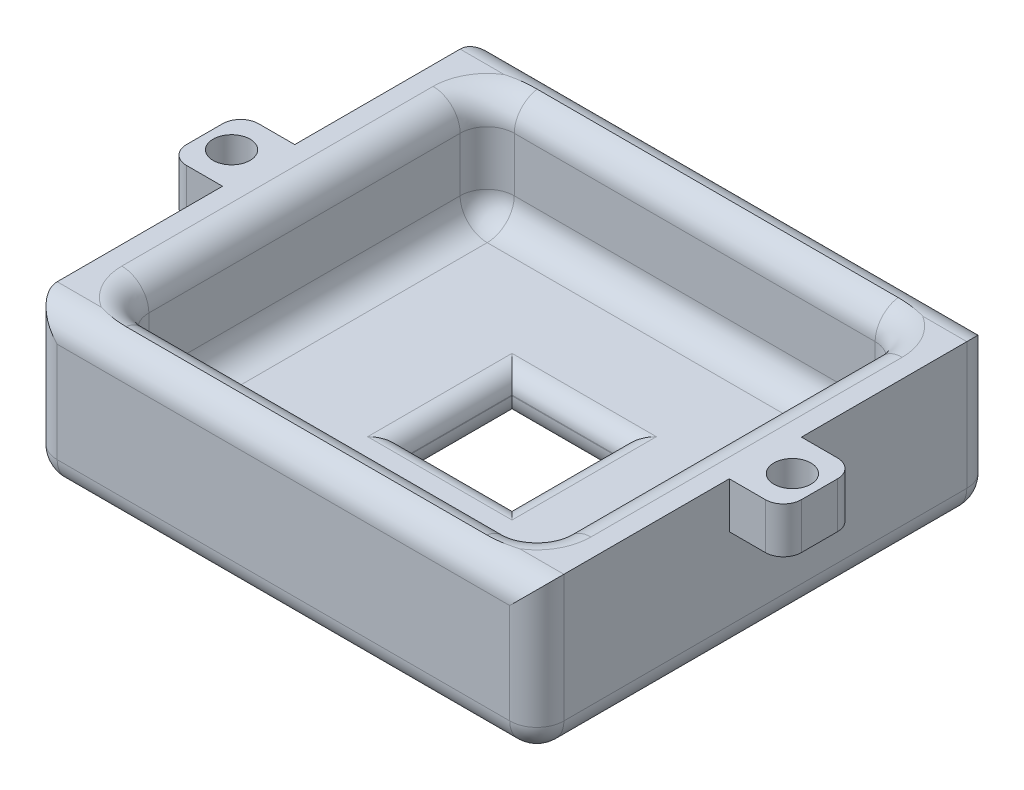
from build123d import *

# Parameters (mm, degrees)
SKETCH1_W           = 56.16
SKETCH1_H           = 50.66
SKETCH1_W_2         = 46
SKETCH1_H_2         = 40.5
BOSS_EXTRUDE1_DEPTH = 12
SKETCH2_W           = 56.16
SKETCH2_H           = 50.66
BOSS_EXTRUDE2_DEPTH = 5.08
SKETCH3_W           = 12
SKETCH3_H           = 12
CUT_EXTRUDE1_DEPTH  = 5.08
SKETCH4_W           = 8
SKETCH4_H           = 5.08
BOSS_EXTRUDE3_DEPTH = 6
SKETCH5_W           = 8
SKETCH5_H           = 5.08
BOSS_EXTRUDE4_DEPTH = 6
SKETCH6_R           = 2.05
CUT_EXTRUDE2_DEPTH  = 6
FILLET1_R           = 3
FILLET2_R           = 2
FILLET3_R           = 2


with BuildPart() as part:
    # Sketch1 → Boss-Extrude1 (new body)
    with BuildSketch(Plane(origin=(0, 0, 0), x_dir=(1, 0, 0), z_dir=(0, 1, 0))):
        with Locations((4.455, -0.70125)):
            Rectangle(SKETCH1_W, SKETCH1_H)
        with Locations((4.455, -0.70125)):
            Rectangle(SKETCH1_W_2, SKETCH1_H_2, mode=Mode.SUBTRACT)
    extrude(amount=BOSS_EXTRUDE1_DEPTH)

    # Sketch2 → Boss-Extrude2 (add)
    with BuildSketch(Plane.XZ):
        with Locations((4.455, 0.70125)):
            Rectangle(SKETCH2_W, SKETCH2_H)
    extrude(amount=BOSS_EXTRUDE2_DEPTH)

    # Sketch3 → Cut-Extrude1 (cut)
    with BuildSketch(Plane.XZ.offset(5.08)):
        with Locations((4.455, 0.70125)):
            Rectangle(SKETCH3_W, SKETCH3_H)
    extrude(amount=-CUT_EXTRUDE1_DEPTH, mode=Mode.SUBTRACT)

    # Sketch4 → Boss-Extrude3 (add)
    with BuildSketch(Plane(origin=(32.535, 0, 0), x_dir=(0, 0, -1), z_dir=(1, 0, 0))):
        with Locations((-0.70125, 9.46)):
            Rectangle(SKETCH4_W, SKETCH4_H)
    extrude(amount=BOSS_EXTRUDE3_DEPTH)

    # Sketch5 → Boss-Extrude4 (add)
    with BuildSketch(Plane.ZY.offset(23.625)):
        with Locations((0.70125, 9.46)):
            Rectangle(SKETCH5_W, SKETCH5_H)
    extrude(amount=BOSS_EXTRUDE4_DEPTH)

    # Sketch6 → Cut-Extrude2 (cut)
    with BuildSketch(Plane.XZ.offset(-6.92)):
        with Locations(Location((35.535, 0.70125, 0), (0, 0, 270))):
            Circle(SKETCH6_R)
        with Locations(Location((-26.625, 0.70125, 0), (0, 0, 270))):
            Circle(SKETCH6_R)
    extrude(amount=-CUT_EXTRUDE2_DEPTH, mode=Mode.SUBTRACT)

    # Fillet1
    # the kernel refuses this fillet: 3 mm, written as the material it adds along each edge
    with BuildSketch(Plane(origin=(-15.545, 3, 17.95125), x_dir=(-1, 0, 0), z_dir=(0, -1, 0))) as fillet1_piece_1_section:
        Polygon((0, 0), (FILLET1_R, 0), (FILLET1_R, -FILLET1_R), (0, -FILLET1_R), align=None)
    fillet1_piece_1 = extrude(amount=FILLET1_R, mode=Mode.PRIVATE)
    fillet1_piece_1 = fillet1_piece_1 - Plane(origin=(-15.545, 3, 17.95125), x_dir=(0.7071067811865475, 0, -0.7071067811865475), z_dir=(0, -1, 0)) * Sphere(FILLET1_R, mode=Mode.PRIVATE)
    add(fillet1_piece_1)
    with BuildSketch(Plane(origin=(-15.545, 3, -16.54875), x_dir=(-1, 0, 0), z_dir=(0, -1, 0))) as fillet1_piece_2_section:
        Polygon((0, 0), (FILLET1_R, 0), (FILLET1_R, FILLET1_R), (0, FILLET1_R), align=None)
    fillet1_piece_2 = extrude(amount=FILLET1_R, mode=Mode.PRIVATE)
    fillet1_piece_2 = fillet1_piece_2 - Plane(origin=(-15.545, 3, -16.54875), x_dir=(0.7071067811865476, 0, 0.7071067811865475), z_dir=(0, -1, 0)) * Sphere(FILLET1_R, mode=Mode.PRIVATE)
    add(fillet1_piece_2)
    with BuildSketch(Plane(origin=(24.455, 3, 17.95125), x_dir=(1, 0, 0), z_dir=(0, -1, 0))) as fillet1_piece_3_section:
        Polygon((0, 0), (FILLET1_R, 0), (FILLET1_R, FILLET1_R), (0, FILLET1_R), align=None)
    fillet1_piece_3 = extrude(amount=FILLET1_R, mode=Mode.PRIVATE)
    fillet1_piece_3 = fillet1_piece_3 - Plane(origin=(24.455, 3, 17.95125), x_dir=(-0.7071067811865476, 0, -0.7071067811865475), z_dir=(0, -1, 0)) * Sphere(FILLET1_R, mode=Mode.PRIVATE)
    add(fillet1_piece_3)
    with BuildSketch(Plane(origin=(24.455, 3, -16.54875), x_dir=(0, -1, 0), z_dir=(1, 0, 0))) as fillet1_piece_4_section:
        Polygon((0, 0), (FILLET1_R, 0), (FILLET1_R, FILLET1_R), (0, FILLET1_R), align=None)
    fillet1_piece_4 = extrude(amount=FILLET1_R, mode=Mode.PRIVATE)
    fillet1_piece_4 = fillet1_piece_4 - Plane(origin=(24.455, 3, -16.54875), x_dir=(0, 0.7071067811865475, 0.7071067811865475), z_dir=(1, 0, 0)) * Sphere(FILLET1_R, mode=Mode.PRIVATE)
    add(fillet1_piece_4)
    with BuildSketch(Plane(origin=(-18.545, 0, 17.95125), x_dir=(0, 1, 0), z_dir=(0, 0, -1)), Plane(origin=(27.455, 0, -16.54875), x_dir=(0, 1, 0), z_dir=(0, 0, 1))) as fillet1_piece_5:
        with BuildLine():
            CenterArc((FILLET1_R, FILLET1_R), FILLET1_R, 180, 90)
            Line((0, FILLET1_R), (0, 0))
            Line((0, 0), (FILLET1_R, 0))
        make_face()
    extrude(amount=34.5)
    with BuildSketch(Plane(origin=(-18.545, 3, -19.54875), x_dir=(0, 0, 1), z_dir=(0, 1, 0)), Plane(origin=(27.455, 3, -19.54875), x_dir=(-1, 0, 0), z_dir=(0, 1, 0))) as fillet1_piece_6:
        with BuildLine():
            CenterArc((FILLET1_R, FILLET1_R), FILLET1_R, 180, 90)
            Line((0, FILLET1_R), (0, 0))
            Line((0, 0), (FILLET1_R, 0))
        make_face()
    extrude(amount=9)
    with BuildSketch(Plane(origin=(24.455, 0, 20.95125), x_dir=(0, 1, 0), z_dir=(-1, 0, 0)), Plane(origin=(-15.545, 0, -19.54875), x_dir=(0, 1, 0), z_dir=(1, 0, 0))) as fillet1_piece_7:
        with BuildLine():
            CenterArc((FILLET1_R, FILLET1_R), FILLET1_R, 180, 90)
            Line((0, FILLET1_R), (0, 0))
            Line((0, 0), (FILLET1_R, 0))
        make_face()
    extrude(amount=40)
    with BuildSketch(Plane(origin=(-18.545, 3, 20.95125), x_dir=(0, 0, -1), z_dir=(0, 1, 0)), Plane(origin=(27.455, 3, 20.95125), x_dir=(-1, 0, 0), z_dir=(0, 1, 0))) as fillet1_piece_8:
        with BuildLine():
            CenterArc((FILLET1_R, -FILLET1_R), FILLET1_R, 90, 90)
            Line((0, -FILLET1_R), (0, 0))
            Line((0, 0), (FILLET1_R, 0))
        make_face()
    extrude(amount=9)
    # the kernel refuses this fillet: 3 mm, written as the material it takes off along each edge
    with BuildSketch(Plane(origin=(29.535, -2.08, -21.62875), x_dir=(1, 0, 0), z_dir=(0, 0, -1))) as fillet1_2_piece_1_section:
        Polygon((0, 0), (FILLET1_R, 0), (FILLET1_R, FILLET1_R), (0, FILLET1_R), align=None)
    fillet1_2_piece_1 = extrude(amount=FILLET1_R, mode=Mode.PRIVATE)
    fillet1_2_piece_1 = fillet1_2_piece_1 - Plane(origin=(29.535, -2.08, -21.62875), x_dir=(-0.7071067811865475, 0.7071067811865475, 0), z_dir=(0, 0, -1)) * Sphere(FILLET1_R, mode=Mode.PRIVATE)
    add(fillet1_2_piece_1, mode=Mode.SUBTRACT)
    with BuildSketch(Plane(origin=(29.535, -2.08, 23.03125), x_dir=(1, 0, 0), z_dir=(0, 0, 1))) as fillet1_2_piece_2_section:
        Polygon((0, 0), (FILLET1_R, 0), (FILLET1_R, -FILLET1_R), (0, -FILLET1_R), align=None)
    fillet1_2_piece_2 = extrude(amount=FILLET1_R, mode=Mode.PRIVATE)
    fillet1_2_piece_2 = fillet1_2_piece_2 - Plane(origin=(29.535, -2.08, 23.03125), x_dir=(-0.7071067811865475, 0.7071067811865475, 0), z_dir=(0, 0, 1)) * Sphere(FILLET1_R, mode=Mode.PRIVATE)
    add(fillet1_2_piece_2, mode=Mode.SUBTRACT)
    with BuildSketch(Plane(origin=(-20.625, -2.08, 23.03125), x_dir=(0, -1, 0), z_dir=(0, 0, 1))) as fillet1_2_piece_3_section:
        Polygon((0, 0), (FILLET1_R, 0), (FILLET1_R, -FILLET1_R), (0, -FILLET1_R), align=None)
    fillet1_2_piece_3 = extrude(amount=FILLET1_R, mode=Mode.PRIVATE)
    fillet1_2_piece_3 = fillet1_2_piece_3 - Plane(origin=(-20.625, -2.08, 23.03125), x_dir=(0.7071067811865475, 0.7071067811865475, 0), z_dir=(0, 0, 1)) * Sphere(FILLET1_R, mode=Mode.PRIVATE)
    add(fillet1_2_piece_3, mode=Mode.SUBTRACT)
    with BuildSketch(Plane(origin=(-20.625, -2.08, -21.62875), x_dir=(0, -1, 0), z_dir=(0, 0, -1))) as fillet1_2_piece_4_section:
        Polygon((0, 0), (FILLET1_R, 0), (FILLET1_R, FILLET1_R), (0, FILLET1_R), align=None)
    fillet1_2_piece_4 = extrude(amount=FILLET1_R, mode=Mode.PRIVATE)
    fillet1_2_piece_4 = fillet1_2_piece_4 - Plane(origin=(-20.625, -2.08, -21.62875), x_dir=(0.7071067811865475, 0.7071067811865475, 0), z_dir=(0, 0, -1)) * Sphere(FILLET1_R, mode=Mode.PRIVATE)
    add(fillet1_2_piece_4, mode=Mode.SUBTRACT)
    with BuildSketch(Plane(origin=(-31.125, 12, -24.62875), x_dir=(0, -1, 0), z_dir=(1, 0, 0))) as fillet1_2_piece_5:
        with BuildLine():
            CenterArc((FILLET1_R, -FILLET1_R), FILLET1_R, 90, 90)
            Line((0, -FILLET1_R), (0, 0))
            Line((0, 0), (FILLET1_R, 0))
        make_face()
    extrude(amount=71.16, mode=Mode.SUBTRACT)
    with BuildSketch(Plane(origin=(32.535, -5.08, -21.62875), x_dir=(0, 1, 0), z_dir=(0, 0, 1))) as fillet1_2_piece_6:
        with BuildLine():
            CenterArc((FILLET1_R, FILLET1_R), FILLET1_R, 180, 90)
            Line((0, FILLET1_R), (0, 0))
            Line((0, 0), (FILLET1_R, 0))
        make_face()
    extrude(amount=44.66, mode=Mode.SUBTRACT)
    with BuildSketch(Plane(origin=(29.535, -5.08, 26.03125), x_dir=(0, 0, -1), z_dir=(-1, 0, 0))) as fillet1_2_piece_7:
        with BuildLine():
            CenterArc((FILLET1_R, -FILLET1_R), FILLET1_R, 90, 90)
            Line((0, -FILLET1_R), (0, 0))
            Line((0, 0), (FILLET1_R, 0))
        make_face()
    extrude(amount=50.16, mode=Mode.SUBTRACT)
    with BuildSketch(Plane(origin=(-23.625, -5.08, 23.03125), x_dir=(1, 0, 0), z_dir=(0, 0, -1))) as fillet1_2_piece_8:
        with BuildLine():
            CenterArc((FILLET1_R, -FILLET1_R), FILLET1_R, 90, 90)
            Line((0, -FILLET1_R), (0, 0))
            Line((0, 0), (FILLET1_R, 0))
        make_face()
    extrude(amount=44.66, mode=Mode.SUBTRACT)
    with BuildSketch(Plane(origin=(-20.625, -5.08, -24.62875), x_dir=(0, 1, 0), z_dir=(1, 0, 0))) as fillet1_2_piece_9:
        with BuildLine():
            CenterArc((FILLET1_R, FILLET1_R), FILLET1_R, 180, 90)
            Line((0, FILLET1_R), (0, 0))
            Line((0, 0), (FILLET1_R, 0))
        make_face()
    extrude(amount=50.16, mode=Mode.SUBTRACT)
    with BuildSketch(Plane(origin=(10.455, -5.08, 6.70125), x_dir=(1, 0, 0), z_dir=(0, 0, -1)), Plane(origin=(-1.545, -5.08, 6.70125), x_dir=(0, 0, 1), z_dir=(1, 0, 0)), Plane(origin=(-1.545, -5.08, -5.29875), x_dir=(-1, 0, 0), z_dir=(0, 0, 1)), Plane(origin=(10.455, -5.08, -5.29875), x_dir=(0, 0, -1), z_dir=(-1, 0, 0))) as fillet1_2_piece_10:
        with BuildLine():
            CenterArc((FILLET1_R, -FILLET1_R), FILLET1_R, 90, 90)
            Line((0, -FILLET1_R), (0, 0))
            Line((0, 0), (FILLET1_R, 0))
        make_face()
    extrude(amount=12, mode=Mode.SUBTRACT)
    with BuildSketch(Plane(origin=(-23.625, -2.08, -24.62875), x_dir=(1, 0, 0), z_dir=(0, 1, 0)), Plane(origin=(32.535, 19.5, -24.62875), x_dir=(-1, 0, 0), z_dir=(0, -1, 0)), Plane(origin=(32.535, 19.5, 26.03125), x_dir=(0, 0, -1), z_dir=(0, -1, 0)), Plane(origin=(-23.625, -2.08, 26.03125), x_dir=(0, 0, -1), z_dir=(0, 1, 0))) as fillet1_2_piece_11:
        with BuildLine():
            CenterArc((FILLET1_R, -FILLET1_R), FILLET1_R, 90, 90)
            Line((0, -FILLET1_R), (0, 0))
            Line((0, 0), (FILLET1_R, 0))
        make_face()
    extrude(amount=21.58, mode=Mode.SUBTRACT)
    with BuildSketch(Plane(origin=(40.035, 12, 26.03125), x_dir=(0, 0, -1), z_dir=(-1, 0, 0))) as fillet1_2_piece_12:
        with BuildLine():
            CenterArc((FILLET1_R, FILLET1_R), FILLET1_R, 180, 90)
            Line((0, FILLET1_R), (0, 0))
            Line((0, 0), (FILLET1_R, 0))
        make_face()
    extrude(amount=71.16, mode=Mode.SUBTRACT)
    with BuildSketch(Plane(origin=(10.455, -5.08, 14.20125), x_dir=(1, 0, 0), z_dir=(0, 0, -1))) as fillet1_2_piece_13a_section:
        with BuildLine():
            CenterArc((FILLET1_R, -FILLET1_R), FILLET1_R, 90, 90)
            Line((0, -FILLET1_R), (0, 0))
            Line((0, 0), (FILLET1_R, 0))
        make_face()
    fillet1_2_piece_13a = extrude(amount=19.5, mode=Mode.PRIVATE)
    fillet1_2_piece_13a = split(fillet1_2_piece_13a, bisect_by=Plane(origin=(11.134185343, -4.400814657, 6.70125), z_dir=(0, 0, 1)), keep=Keep.TOP, mode=Mode.PRIVATE)
    with BuildSketch(Plane(origin=(-1.545, -5.08, 6.70125), x_dir=(0, 0, 1), z_dir=(1, 0, 0))) as fillet1_2_piece_13b_section:
        with BuildLine():
            CenterArc((FILLET1_R, -FILLET1_R), FILLET1_R, 90, 90)
            Line((0, -FILLET1_R), (0, 0))
            Line((0, 0), (FILLET1_R, 0))
        make_face()
    fillet1_2_piece_13b = extrude(amount=19.5, mode=Mode.PRIVATE)
    fillet1_2_piece_13b = split(fillet1_2_piece_13b, bisect_by=Plane(origin=(10.455, -4.400814657, 7.380435343), z_dir=(1, 0, 0)), keep=Keep.TOP, mode=Mode.PRIVATE)
    fillet1_2_piece_13 = fillet1_2_piece_13a & fillet1_2_piece_13b
    add(fillet1_2_piece_13, mode=Mode.SUBTRACT)
    with BuildSketch(Plane(origin=(10.455, -5.08, 6.70125), x_dir=(1, 0, 0), z_dir=(0, 0, -1))) as fillet1_2_piece_14a_section:
        with BuildLine():
            CenterArc((FILLET1_R, -FILLET1_R), FILLET1_R, 90, 90)
            Line((0, -FILLET1_R), (0, 0))
            Line((0, 0), (FILLET1_R, 0))
        make_face()
    fillet1_2_piece_14a = extrude(amount=19.5, mode=Mode.PRIVATE)
    fillet1_2_piece_14a = split(fillet1_2_piece_14a, bisect_by=Plane(origin=(11.134185343, -4.400814657, -5.29875), z_dir=(0, 0, -1)), keep=Keep.TOP, mode=Mode.PRIVATE)
    with BuildSketch(Plane(origin=(17.955, -5.08, -5.29875), x_dir=(0, 0, -1), z_dir=(-1, 0, 0))) as fillet1_2_piece_14b_section:
        with BuildLine():
            CenterArc((FILLET1_R, -FILLET1_R), FILLET1_R, 90, 90)
            Line((0, -FILLET1_R), (0, 0))
            Line((0, 0), (FILLET1_R, 0))
        make_face()
    fillet1_2_piece_14b = extrude(amount=19.5, mode=Mode.PRIVATE)
    fillet1_2_piece_14b = split(fillet1_2_piece_14b, bisect_by=Plane(origin=(10.455, -4.400814657, -5.977935343), z_dir=(1, 0, 0)), keep=Keep.TOP, mode=Mode.PRIVATE)
    fillet1_2_piece_14 = fillet1_2_piece_14a & fillet1_2_piece_14b
    add(fillet1_2_piece_14, mode=Mode.SUBTRACT)
    with BuildSketch(Plane(origin=(-9.045, -5.08, 6.70125), x_dir=(0, 0, 1), z_dir=(1, 0, 0))) as fillet1_2_piece_15a_section:
        with BuildLine():
            CenterArc((FILLET1_R, -FILLET1_R), FILLET1_R, 90, 90)
            Line((0, -FILLET1_R), (0, 0))
            Line((0, 0), (FILLET1_R, 0))
        make_face()
    fillet1_2_piece_15a = extrude(amount=19.5, mode=Mode.PRIVATE)
    fillet1_2_piece_15a = split(fillet1_2_piece_15a, bisect_by=Plane(origin=(-1.545, -4.400814657, 7.380435343), z_dir=(-1, 0, 0)), keep=Keep.TOP, mode=Mode.PRIVATE)
    with BuildSketch(Plane(origin=(-1.545, -5.08, -5.29875), x_dir=(-1, 0, 0), z_dir=(0, 0, 1))) as fillet1_2_piece_15b_section:
        with BuildLine():
            CenterArc((FILLET1_R, -FILLET1_R), FILLET1_R, 90, 90)
            Line((0, -FILLET1_R), (0, 0))
            Line((0, 0), (FILLET1_R, 0))
        make_face()
    fillet1_2_piece_15b = extrude(amount=19.5, mode=Mode.PRIVATE)
    fillet1_2_piece_15b = split(fillet1_2_piece_15b, bisect_by=Plane(origin=(-2.224185343, -4.400814657, 6.70125), z_dir=(0, 0, 1)), keep=Keep.TOP, mode=Mode.PRIVATE)
    fillet1_2_piece_15 = fillet1_2_piece_15a & fillet1_2_piece_15b
    add(fillet1_2_piece_15, mode=Mode.SUBTRACT)
    with BuildSketch(Plane(origin=(-1.545, -5.08, -12.79875), x_dir=(-1, 0, 0), z_dir=(0, 0, 1))) as fillet1_2_piece_16a_section:
        with BuildLine():
            CenterArc((FILLET1_R, -FILLET1_R), FILLET1_R, 90, 90)
            Line((0, -FILLET1_R), (0, 0))
            Line((0, 0), (FILLET1_R, 0))
        make_face()
    fillet1_2_piece_16a = extrude(amount=19.5, mode=Mode.PRIVATE)
    fillet1_2_piece_16a = split(fillet1_2_piece_16a, bisect_by=Plane(origin=(-2.224185343, -4.400814657, -5.29875), z_dir=(0, 0, -1)), keep=Keep.TOP, mode=Mode.PRIVATE)
    with BuildSketch(Plane(origin=(10.455, -5.08, -5.29875), x_dir=(0, 0, -1), z_dir=(-1, 0, 0))) as fillet1_2_piece_16b_section:
        with BuildLine():
            CenterArc((FILLET1_R, -FILLET1_R), FILLET1_R, 90, 90)
            Line((0, -FILLET1_R), (0, 0))
            Line((0, 0), (FILLET1_R, 0))
        make_face()
    fillet1_2_piece_16b = extrude(amount=19.5, mode=Mode.PRIVATE)
    fillet1_2_piece_16b = split(fillet1_2_piece_16b, bisect_by=Plane(origin=(-1.545, -4.400814657, -5.977935343), z_dir=(-1, 0, 0)), keep=Keep.TOP, mode=Mode.PRIVATE)
    fillet1_2_piece_16 = fillet1_2_piece_16a & fillet1_2_piece_16b
    add(fillet1_2_piece_16, mode=Mode.SUBTRACT)
    # the kernel refuses this fillet: 3 mm, written as the material it takes off along each edge
    with BuildSketch(Plane(origin=(-18.545, 12, 17.95125), x_dir=(-1, 0, 0), z_dir=(0, 0, -1)), Plane(origin=(27.455, 12, -16.54875), x_dir=(1, 0, 0), z_dir=(0, 0, 1))) as fillet1_3_piece_1:
        with BuildLine():
            CenterArc((FILLET1_R, -FILLET1_R), FILLET1_R, 90, 90)
            Line((0, -FILLET1_R), (0, 0))
            Line((0, 0), (FILLET1_R, 0))
        make_face()
    extrude(amount=34.5, mode=Mode.SUBTRACT)
    with BuildSketch(Plane(origin=(24.455, 12, 20.95125), x_dir=(0, 0, 1), z_dir=(-1, 0, 0)), Plane(origin=(-15.545, 12, -19.54875), x_dir=(0, 0, -1), z_dir=(1, 0, 0))) as fillet1_3_piece_2:
        with BuildLine():
            CenterArc((FILLET1_R, -FILLET1_R), FILLET1_R, 90, 90)
            Line((0, -FILLET1_R), (0, 0))
            Line((0, 0), (FILLET1_R, 0))
        make_face()
    extrude(amount=40, mode=Mode.SUBTRACT)
    with BuildSketch(Plane(origin=(-15.545, 12, -16.54875), x_dir=(-1, 0, 0), z_dir=(0, 0, 1))) as fillet1_3_piece_3:
        with BuildLine():
            CenterArc((3 + FILLET1_R, FILLET1_R), FILLET1_R, 180, 90)
            Line((3, FILLET1_R), (3, 0))
            Line((3, 0), (3 + FILLET1_R, 0))
        make_face()
    revolve(axis=Axis((-15.545, 12, -16.54875), (0, -1, 0)), revolution_arc=90, mode=Mode.SUBTRACT)
    with BuildSketch(Plane(origin=(24.455, 12, -16.54875), x_dir=(0, 0, -1), z_dir=(-1, 0, 0))) as fillet1_3_piece_4:
        with BuildLine():
            CenterArc((3 + FILLET1_R, FILLET1_R), FILLET1_R, 180, 90)
            Line((3, FILLET1_R), (3, 0))
            Line((3, 0), (3 + FILLET1_R, 0))
        make_face()
    revolve(axis=Axis((24.455, 12, -16.54875), (0, -1, 0)), revolution_arc=90, mode=Mode.SUBTRACT)
    with BuildSketch(Plane(origin=(24.455, 12, 17.95125), x_dir=(0, 0, 1), z_dir=(-1, 0, 0))) as fillet1_3_piece_5:
        with BuildLine():
            CenterArc((3 + FILLET1_R, -FILLET1_R), FILLET1_R, 90, 90)
            Line((3, -FILLET1_R), (3, 0))
            Line((3, 0), (3 + FILLET1_R, 0))
        make_face()
    revolve(axis=Axis((24.455, 12, 17.95125), (0, 1, 0)), revolution_arc=90, mode=Mode.SUBTRACT)
    with BuildSketch(Plane(origin=(-15.545, 12, 17.95125), x_dir=(-1, 0, 0), z_dir=(0, 0, -1))) as fillet1_3_piece_6:
        with BuildLine():
            CenterArc((3 + FILLET1_R, -FILLET1_R), FILLET1_R, 90, 90)
            Line((3, -FILLET1_R), (3, 0))
            Line((3, 0), (3 + FILLET1_R, 0))
        make_face()
    revolve(axis=Axis((-15.545, 12, 17.95125), (0, 1, 0)), revolution_arc=90, mode=Mode.SUBTRACT)

    # Fillet2
    fillet2_edges = [part.edges().sort_by_distance(p)[0] for p in [
        (38.535, 9.46, 4.70125),
        (38.535, 9.46, -3.29875),
        (-29.625, 9.46, 4.70125),
        (-29.625, 9.46, -3.29875),
    ]]
    fillet(fillet2_edges, radius=FILLET2_R)

    # Fillet3
    fillet3_edges = [part.edges().sort_by_distance(p)[0] for p in [
        (10.455, 0, 0.70125),
        (4.455, 0, -5.29875),
        (-1.545, 0, 0.70125),
        (4.455, 0, 6.70125),
    ]]
    fillet(fillet3_edges, radius=FILLET3_R)


solid = part.part
